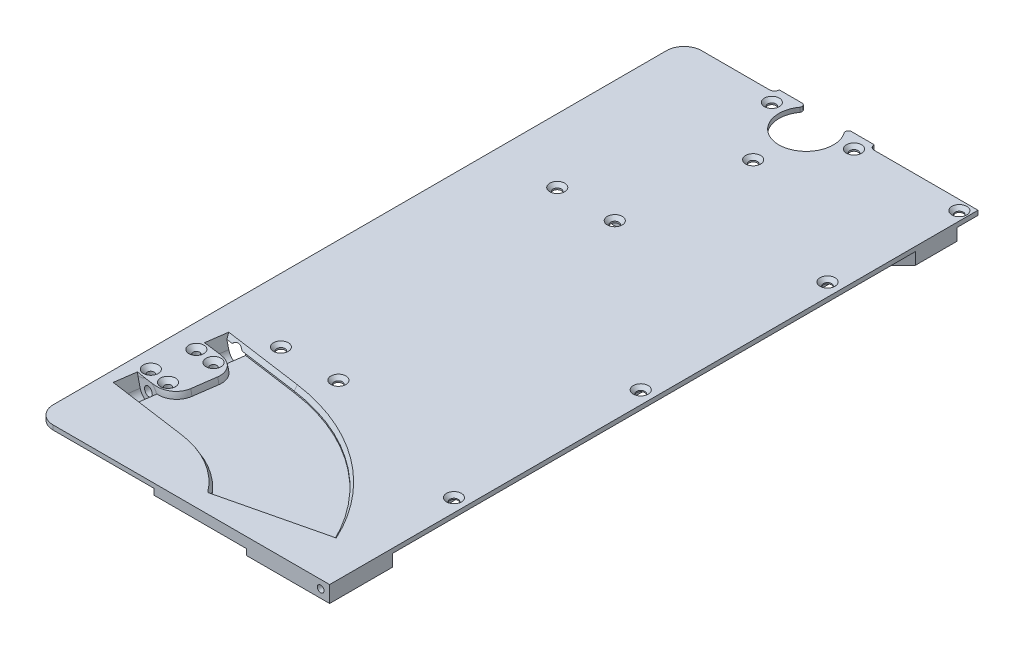
from build123d import *

# Parameters (mm, degrees)
BOSS_EXTRUDE1_DEPTH  = 1.2
SKETCH4_W            = 62.7
SKETCH4_H            = 158
BOSS_EXTRUDE3_DEPTH  = 3.2
SKETCH6_W            = 13.5
SKETCH6_H            = 11.65
SKETCH6_R            = 1.1
SKETCH6_H_2          = 29.2
BOSS_EXTRUDE4_DEPTH  = 5.1
SKETCH7_W            = 0.1
SKETCH7_H            = 11.65
SKETCH7_H_2          = 29.2
BOSS_EXTRUDE5_DEPTH  = 3.2
CUT_EXTRUDE5_DEPTH   = 5.1
CUT_EXTRUDE6_DEPTH   = 5.2
SKETCH11_R           = 1.2
CUT_EXTRUDE7_DEPTH   = 5.4
CUT_EXTRUDE8_DEPTH   = 5
BOSS_EXTRUDE6_DEPTH  = 5
CUT_EXTRUDE9_DEPTH   = 5
BOSS_EXTRUDE7_START  = 5
BOSS_EXTRUDE7_DEPTH  = 5
SKETCH20_W           = 8
SKETCH20_H           = 6
CUT_EXTRUDE10_DEPTH  = 3.6
CUT_EXTRUDE12_DEPTH  = 1.8
CUT_EXTRUDE13_START  = -5.4
SKETCH23_R           = 1.2
CUT_EXTRUDE13_DEPTH  = 5.4
SKETCH24_R           = 0.9
CUT_EXTRUDE14_DEPTH  = 96.780634786
CHAMFER1_SIZE        = 1.1
SKETCH26_R           = 2
CUT_EXTRUDE15_DEPTH  = 12
CUT_EXTRUDE16_START  = 12
SKETCH27_R           = 2
CUT_EXTRUDE16_DEPTH  = 12
CUT_EXTRUDE17_START  = -3.6
CUT_EXTRUDE17_DEPTH  = 1.8
CUT_EXTRUDE18_REACH  = 97.781
SKETCH29_W           = 6.8
SKETCH29_H           = 6.1
CUT_EXTRUDE19_DEPTH  = 3.2
CUT_EXTRUDE20_REACH  = 97.781
SKETCH32_R           = 1.1
CHAMFER2_SIZE        = 0.9
SKETCH34_W           = 47.06
SKETCH34_H           = 10
BOSS_EXTRUDE8_DEPTH  = 1.6
SKETCH35_W           = 22.2
SKETCH35_H           = 10
BOSS_EXTRUDE9_DEPTH  = 1.6
CUT_EXTRUDE21_DEPTH  = 1.6
SKETCH44_R           = 0.9
CUT_EXTRUDE22_DEPTH  = 9
CUT_EXTRUDE23_REACH  = 97.781
SKETCH45_R           = 1.1
CHAMFER3_SIZE        = 0.9
CUT_EXTRUDE24_DEPTH  = 1.8
CHAMFER4_SIZE        = 0.692820323
CHAMFER4_SIZE_2      = 1.2
CUT_EXTRUDE25_DEPTH  = 4
BOSS_EXTRUDE10_START = 0.9
BOSS_EXTRUDE10_DEPTH = 0.9
SKETCH57_R           = 1.1
CUT_EXTRUDE26_DEPTH  = 1.3
CUT_EXTRUDE27_DEPTH  = 0.9
CHAMFER5_SIZE        = 0.9
SKETCH59_W           = 35.8
SKETCH59_H           = 15.9
CUT_EXTRUDE28_DEPTH  = 0.4
SKETCH60_W           = 1.2
SKETCH60_H           = 15.9
CUT_EXTRUDE29_DEPTH  = 3.6
FILLET1_R            = 1.2
CUT_EXTRUDE30_DEPTH  = 3.2
SKETCH62_R           = 2.3
BOSS_EXTRUDE11_DEPTH = 0.1
SKETCH63_R           = 1.1
CUT_EXTRUDE31_DEPTH  = 1.3
CHAMFER6_SIZE        = 0.9
BOSS_EXTRUDE12_DEPTH = 1.2
CUT_EXTRUDE32_REACH  = 98.89
CUT_EXTRUDE33_DEPTH  = 3.1
SKETCH67_W           = 2.4
SKETCH67_H           = 2.9
CUT_EXTRUDE34_DEPTH  = 4
FILLET2_R            = 1.2
SKETCH68_W           = 2.2
SKETCH68_H           = 5
CUT_EXTRUDE35_DEPTH  = 0.2
SKETCH69_W           = 2.2
SKETCH69_H           = 2.2
CUT_EXTRUDE36_DEPTH  = 0.2


with BuildPart() as part:
    # Sketch1 → Boss-Extrude1 (new body)
    with BuildSketch(Plane(origin=(0, 0, 0), x_dir=(1, 0, 0), z_dir=(0, 1, 0))):
        with BuildLine():
            Line((40, 86.8), (-34, 86.8))
            ThreePointArc((-34, 86.8), (-37.323401872, 85.423401872), (-38.7, 82.1))
            Line((-38.7, 82.1), (-38.7, -82.1))
            ThreePointArc((-38.7, -82.1), (-37.323401872, -85.423401872), (-34, -86.8))
            Line((-34, -86.8), (40, -86.8))
            Line((40, -86.8), (40, 86.8))
        make_face()
    extrude(amount=-BOSS_EXTRUDE1_DEPTH)

    # Sketch4 → Boss-Extrude3 (add)
    with BuildSketch(Plane(origin=(0, -1.2, 0), x_dir=(-1, 0, 0), z_dir=(0, -1, 0))):
        with Locations((-8.65, 2.2)):
            Rectangle(SKETCH4_W, SKETCH4_H)
    extrude(amount=BOSS_EXTRUDE3_DEPTH)

    # Sketch6 → Boss-Extrude4 (add)
    # profile 1 of 2: a face of its own
    with BuildSketch(Plane.XZ.offset(1.2)):
        with Locations((-29.55, -70.575)):
            Rectangle(SKETCH6_W, SKETCH6_H)
        with Locations(Location((-25.5, -68.35, 0), (0, 0, 270))):
            Circle(SKETCH6_R, mode=Mode.SUBTRACT)
    # profile 2 of 2: a face of its own
    with BuildSketch(Plane.XZ.offset(1.2)):
        with Locations((-29.55, 56.05)):
            Rectangle(SKETCH6_W, SKETCH6_H_2)
        with Locations(Location((-25.5, 56.05, 0), (0, 0, 270))):
            Circle(SKETCH6_R, mode=Mode.SUBTRACT)
    extrude(amount=BOSS_EXTRUDE4_DEPTH)

    # Sketch7 → Boss-Extrude5 (add)
    with BuildSketch(Plane.XZ.offset(1.2)):
        with Locations((-22.75, -70.575)):
            Rectangle(SKETCH7_W, SKETCH7_H)
        with Locations((-22.75, 56.05)):
            Rectangle(SKETCH7_W, SKETCH7_H_2)
    extrude(amount=BOSS_EXTRUDE5_DEPTH)

    # Sketch10 → Cut-Extrude5 (cut)
    with BuildSketch(Plane.XZ.offset(6.3)):
        Polygon((-25.959839262, 43.33044604), (-25.695559806, 41.45), (-39.339908081, 41.45), align=None)
        Polygon((-29.578339887, 69.077415827), (-29.79935218, 70.65), (-36.3, 70.65), (-36.3, 68.132748105), align=None)
    extrude(amount=-CUT_EXTRUDE5_DEPTH, mode=Mode.SUBTRACT)

    # Sketch9 → Cut-Extrude6 (cut)
    with BuildSketch(Plane(origin=(0, 0, 0), x_dir=(1, 0, 0), z_dir=(0, 1, 0))):
        Polygon((-34.925787458, -68.325881082), (-34.229921954, -63.374540738), (-28.882474382, -64.126075484), (-29.578339887, -69.077415827), align=None)
        Polygon((-25.959839262, -43.33044604), (-31.307286833, -42.578911295), (-32.003152338, -47.530251639), (-26.655704767, -48.281786384), align=None)
    extrude(amount=-CUT_EXTRUDE6_DEPTH, mode=Mode.SUBTRACT)

    # Sketch11 → Cut-Extrude7 (cut)
    with BuildSketch(Plane(origin=(-9.39719998, 0, 66.864552213), x_dir=(0.9902680687415714, 0, 0.13917310096005855), z_dir=(-0.13917310096005855, 0, 0.9902680687415714))):
        with Locations((-22.37676735, -2.5)):
            Circle(SKETCH11_R)
    extrude(amount=-CUT_EXTRUDE7_DEPTH, mode=Mode.SUBTRACT)

    # Sketch15 → Cut-Extrude8 (cut)
    with BuildSketch(Plane(origin=(-9.39719998, 0, 66.864552213), x_dir=(0.9902680687415714, 0, 0.13917310096005855), z_dir=(-0.13917310096005855, 0, 0.9902680687415714))):
        Polygon((-25.902439291, 0), (-25.07676735, 0), (-25.07676735, -2.879460254), align=None)
    extrude(amount=CUT_EXTRUDE8_DEPTH, mode=Mode.SUBTRACT)

    # Sketch17 → Boss-Extrude6 (add)
    with BuildSketch(Plane(origin=(-9.39719998, 0, 66.864552213), x_dir=(0.9902680687415714, 0, 0.13917310096005855), z_dir=(-0.13917310096005855, 0, 0.9902680687415714))):
        with BuildLine():
            Line((-25.07676735, -2.879460254), (-24.972173929, -3.244220861))
            ThreePointArc((-24.972173929, -3.244220861), (-22.000999977, -5.173723786), (-19.67676735, -2.5))
            Line((-19.67676735, -2.5), (-19.67676735, -6.3))
            Line((-19.67676735, -6.3), (-25.07676735, -6.3))
            Line((-25.07676735, -6.3), (-25.07676735, -2.879460254))
        make_face()
    extrude(amount=BOSS_EXTRUDE6_DEPTH)

    # Sketch18 → Cut-Extrude9 (cut)
    with BuildSketch(Plane(origin=(-7.170430365, 0, 51.020263113), x_dir=(-0.9902680687415715, 0, -0.13917310096005736), z_dir=(0.13917310096005736, 0, -0.9902680687415715))):
        Polygon((25.902439291, 0), (25.07676735, 0), (25.07676735, -2.879460254), align=None)
    extrude(amount=CUT_EXTRUDE9_DEPTH, mode=Mode.SUBTRACT)

    # Sketch19 → Boss-Extrude7 (add)
    with BuildSketch(Plane(origin=(-7.170430365, 0, 51.020263113), x_dir=(-0.9902680687415715, 0, -0.13917310096005736), z_dir=(0.13917310096005736, 0, -0.9902680687415715)).offset(BOSS_EXTRUDE7_START)):
        with BuildLine():
            Line((25.07676735, -2.879460254), (24.972173929, -3.244220861))
            ThreePointArc((24.972173929, -3.244220861), (22.000999977, -5.173723786), (19.67676735, -2.5))
            Line((19.67676735, -2.5), (19.67676735, -6.3))
            Line((19.67676735, -6.3), (25.07676735, -6.3))
            Line((25.07676735, -6.3), (25.07676735, -2.879460254))
        make_face()
    extrude(amount=-BOSS_EXTRUDE7_DEPTH)

    # Sketch20 → Cut-Extrude10 (cut)
    with BuildSketch(Plane.XZ.offset(6.3)):
        with Locations((-32.3, 56.05)):
            Rectangle(SKETCH20_W, SKETCH20_H)
    extrude(amount=-CUT_EXTRUDE10_DEPTH, mode=Mode.SUBTRACT)

    # Sketch22 → Cut-Extrude12 (cut)
    with BuildSketch(Plane(origin=(0, -2.7, 0), x_dir=(-1, 0, 0), z_dir=(0, -1, 0))):
        Polygon((24.056624327, -58.55), (26.943375673, -58.55), (28.3, -58.55), (28.3, -53.55), (26.943375673, -53.55), (24.056624327, -53.55), (22.613248654, -56.05), align=None)
    extrude(amount=CUT_EXTRUDE12_DEPTH, mode=Mode.SUBTRACT)

    # Sketch23 → Cut-Extrude13 (cut)
    with BuildSketch(Plane(origin=(-7.170430365, 0, 51.020263113), x_dir=(-0.9902680687415715, 0, -0.13917310096005736), z_dir=(0.13917310096005736, 0, -0.9902680687415715)).offset(CUT_EXTRUDE13_START)):
        with Locations(Location((22.37676735, -2.5, 0), (0, 0, 180))):
            Circle(SKETCH23_R)
    extrude(amount=CUT_EXTRUDE13_DEPTH, mode=Mode.SUBTRACT)

    # Sketch24 → Cut-Extrude14 (cut, through all)
    with BuildSketch(Plane(origin=(0, 0, 0), x_dir=(1, 0, 0), z_dir=(0, 1, 0))):
        with Locations(Location((-32.365002401, -50.104948617, 0), (0, 0, 270))):
            Circle(SKETCH24_R)
        with Locations(Location((-27.01755483, -50.856483363, 0), (0, 0, 270))):
            Circle(SKETCH24_R)
        with Locations(Location((-28.52062432, -61.551378505, 0), (0, 0, 270))):
            Circle(SKETCH24_R)
        with Locations(Location((-33.868071891, -60.79984376, 0), (0, 0, 270))):
            Circle(SKETCH24_R)
    extrude(amount=-CUT_EXTRUDE14_DEPTH, mode=Mode.SUBTRACT)

    # Chamfer1
    chamfer1_edges = [part.edges().sort_by_distance(p)[0] for p in [
        (-32.365002401, 0, 49.204948617),
        (-33.868071891, 0, 59.89984376),
        (-28.52062432, 0, 60.651378505),
        (-27.01755483, 0, 49.956483363),
    ]]
    chamfer(chamfer1_edges, length=CHAMFER1_SIZE)

    # Sketch26 → Cut-Extrude15 (cut)
    with BuildSketch(Plane(origin=(-6.47456486, 0, 46.068922769), x_dir=(-0.9902680687415714, 0, -0.13917310096005867), z_dir=(0.13917310096005867, 0, -0.9902680687415714))):
        with Locations((22.37676735, -2.5)):
            Circle(SKETCH26_R)
    extrude(amount=CUT_EXTRUDE15_DEPTH, mode=Mode.SUBTRACT)

    # Sketch27 → Cut-Extrude16 (cut)
    with BuildSketch(Plane(origin=(-10.093065485, 0, 71.815892556), x_dir=(0.9902680687415714, 0, 0.1391731009600588), z_dir=(-0.1391731009600588, 0, 0.9902680687415714)).offset(CUT_EXTRUDE16_START)):
        with Locations((-22.37676735, -2.5)):
            Circle(SKETCH27_R)
    extrude(amount=-CUT_EXTRUDE16_DEPTH, mode=Mode.SUBTRACT)

    # Sketch28 → Cut-Extrude17 (cut)
    with BuildSketch(Plane.XZ.offset(6.3).offset(CUT_EXTRUDE17_START)):
        Polygon((-26.943375673, -70.85), (-24.056624327, -70.85), (-22.613248654, -68.35), (-24.056624327, -65.85), (-26.943375673, -65.85), (-28.386751346, -65.85), (-28.386751346, -64.75), (-35.186751346, -64.75), (-35.186751346, -70.85), align=None)
    extrude(amount=CUT_EXTRUDE17_DEPTH, mode=Mode.SUBTRACT)

    # Sketch29 → Cut-Extrude18 (cut, up to next)
    with BuildSketch(Plane.XZ.offset(6.3), mode=Mode.PRIVATE) as cut_extrude18_sk1:
        with Locations((-31.786751346, -67.8)):
            Rectangle(SKETCH29_W, SKETCH29_H)
    cut_extrude18_tool1 = extrude(cut_extrude18_sk1.sketch, amount=-CUT_EXTRUDE18_REACH, mode=Mode.PRIVATE) & part.part
    add(cut_extrude18_tool1.solids().sort_by_distance((-31.786751, -6.3, -67.8))[0], mode=Mode.SUBTRACT)

    # Sketch31 → Cut-Extrude19 (cut)
    with BuildSketch(Plane.XZ.offset(4.4)):
        Polygon((40, 70), (32.8, 62.8), (32.8, -62.8), (40, -70), align=None)
    extrude(amount=-CUT_EXTRUDE19_DEPTH, mode=Mode.SUBTRACT)

    # Sketch32 → Cut-Extrude20 (cut, up to next)
    with BuildSketch(Plane(origin=(0, 0, 0), x_dir=(1, 0, 0), z_dir=(0, 1, 0)), mode=Mode.PRIVATE) as cut_extrude20_sk1:
        with Locations(Location((36.5, 50, 0), (0, 0, 270))):
            Circle(SKETCH32_R)
    cut_extrude20_tool1 = extrude(cut_extrude20_sk1.sketch, amount=-CUT_EXTRUDE20_REACH, mode=Mode.PRIVATE) & part.part
    # Sketch32 → Cut-Extrude20 (cut, up to next)
    with BuildSketch(Plane(origin=(0, 0, 0), x_dir=(1, 0, 0), z_dir=(0, 1, 0)), mode=Mode.PRIVATE) as cut_extrude20_sk2:
        with Locations(Location((36.5, 0, 0), (0, 0, 270))):
            Circle(SKETCH32_R)
    cut_extrude20_tool2 = extrude(cut_extrude20_sk2.sketch, amount=-CUT_EXTRUDE20_REACH, mode=Mode.PRIVATE) & part.part
    # Sketch32 → Cut-Extrude20 (cut, up to next)
    with BuildSketch(Plane(origin=(0, 0, 0), x_dir=(1, 0, 0), z_dir=(0, 1, 0)), mode=Mode.PRIVATE) as cut_extrude20_sk3:
        with Locations(Location((36.5, -50, 0), (0, 0, 270))):
            Circle(SKETCH32_R)
    cut_extrude20_tool3 = extrude(cut_extrude20_sk3.sketch, amount=-CUT_EXTRUDE20_REACH, mode=Mode.PRIVATE) & part.part
    add(cut_extrude20_tool1.solids().sort_by_distance((36.5, 0, -50))[0], mode=Mode.SUBTRACT)
    add(cut_extrude20_tool2.solids().sort_by_distance((36.5, 0, 0))[0], mode=Mode.SUBTRACT)
    add(cut_extrude20_tool3.solids().sort_by_distance((36.5, 0, 50))[0], mode=Mode.SUBTRACT)

    # Chamfer2
    chamfer2_edges = [part.edges().sort_by_distance(p)[0] for p in [
        (36.5, 0, -51.1),
        (36.5, 0, -1.1),
        (36.5, 0, 48.9),
    ]]
    chamfer(chamfer2_edges, length=CHAMFER2_SIZE)

    # Sketch34 → Boss-Extrude8 (add)
    with BuildSketch(Plane(origin=(0, -1.2, 0), x_dir=(-1, 0, 0), z_dir=(0, -1, 0))):
        with Locations((-16.47, -81.8)):
            Rectangle(SKETCH34_W, SKETCH34_H)
    extrude(amount=BOSS_EXTRUDE8_DEPTH)

    # Sketch35 → Boss-Extrude9 (add)
    with BuildSketch(Plane.XZ.offset(2.8)):
        with Locations((28.9, 81.8)):
            Rectangle(SKETCH35_W, SKETCH35_H)
    extrude(amount=BOSS_EXTRUDE9_DEPTH)

    # Sketch33 → Cut-Extrude21 (cut)
    with BuildSketch(Plane(origin=(0, 0, 0), x_dir=(1, 0, 0), z_dir=(0, 1, 0))):
        with BuildLine():
            Line((-29.080527996, -64.098240863), (-31.754251782, -63.722473491))
            Line((-31.754251782, -63.722473491), (-32.450117287, -68.673813835))
            Line((-32.450117287, -68.673813835), (-14.392579053, -71.211635331))
            ThreePointArc((-14.392579053, -71.211635331), (-4.943505274, -74.455866069), (2.613784833, -80.990190411))
            Line((2.613784833, -80.990190411), (29.104169117, -74.640190865))
            ThreePointArc((29.104169117, -74.640190865), (12.827852723, -55.045960017), (-10.774078428, -45.464665543))
            Line((-10.774078428, -45.464665543), (-28.831616662, -42.926844047))
            Line((-28.831616662, -42.926844047), (-29.527482166, -47.878184391))
            Line((-29.527482166, -47.878184391), (-26.853758381, -48.253951764))
            ThreePointArc((-26.853758381, -48.253951764), (-23.688338817, -50.118526382), (-22.768502535, -53.675269378))
            Line((-22.768502535, -53.675269378), (-23.659210382, -60.012985018))
            ThreePointArc((-23.659210382, -60.012985018), (-25.523785, -63.178404582), (-29.080527996, -64.098240863))
        make_face()
    extrude(amount=-CUT_EXTRUDE21_DEPTH, mode=Mode.SUBTRACT)

    # Sketch44 → Cut-Extrude22 (cut)
    with BuildSketch(Plane.XY.offset(86.8)):
        with Locations((37.6, -2.2)):
            Circle(SKETCH44_R)
    extrude(amount=-CUT_EXTRUDE22_DEPTH, mode=Mode.SUBTRACT)

    # Sketch45 → Cut-Extrude23 (cut, up to next)
    with BuildSketch(Plane(origin=(0, 0, 0), x_dir=(1, 0, 0), z_dir=(0, 1, 0)), mode=Mode.PRIVATE) as cut_extrude23_sk1:
        with Locations(Location((37.6, 84.2, 0), (0, 0, 270))):
            Circle(SKETCH45_R)
    cut_extrude23_tool1 = extrude(cut_extrude23_sk1.sketch, amount=-CUT_EXTRUDE23_REACH, mode=Mode.PRIVATE) & part.part
    add(cut_extrude23_tool1.solids().sort_by_distance((37.6, 0, -84.2))[0], mode=Mode.SUBTRACT)

    # Chamfer3
    chamfer3_edges = [part.edges().sort_by_distance(p)[0] for p in [
        (37.6, 0, -85.3),
    ]]
    chamfer(chamfer3_edges, length=CHAMFER3_SIZE)

    # Cut-Sweep2: sweep along a path in Sketch54
    with BuildLine(Plane(origin=(-7.170430365, 0, 51.020263113), x_dir=(-0.9902680687415714, 0, -0.13917310096005867), z_dir=(0.13917310096005867, 0, -0.9902680687415714))) as cut_sweep2_path:
        ThreePointArc((19.87676735, -1.6), (21.591001751, 0.038222296), (23.930996266, -0.34491938))
    # Sketch51 → Cut-Sweep2 (sweep, cut)
    with BuildSketch(Plane(origin=(0, -1.6, 0), x_dir=(1, 0, 0), z_dir=(0, 1, 0))):
        with BuildLine():
            Line((-29.080527996, -64.098240863), (-29.776393501, -69.049581207))
            Line((-29.776393501, -69.049581207), (-20.071766427, -70.413477597))
            Line((-20.071766427, -70.413477597), (-16.453265802, -44.666507809))
            Line((-16.453265802, -44.666507809), (-26.157892876, -43.30261142))
            Line((-26.157892876, -43.30261142), (-26.853758381, -48.253951764))
            ThreePointArc((-26.853758381, -48.253951764), (-23.688338817, -50.118526382), (-22.768502535, -53.675269378))
            Line((-22.768502535, -53.675269378), (-23.659210382, -60.012985018))
            ThreePointArc((-23.659210382, -60.012985018), (-25.523785, -63.178404582), (-29.080527996, -64.098240863))
        make_face()
    sweep(path=cut_sweep2_path.line, mode=Mode.SUBTRACT)

    # Sketch53 → Cut-Extrude24 (cut)
    with BuildSketch(Plane(origin=(-21.988115952, -6.366953545, -3.090228169), x_dir=(0.1285029089350593, 0.03720973881399481, -0.9910108161531953), z_dir=(0.9519067631920858, 0.2756373558170021, 0.1337817710578607))):
        with BuildLine():
            Line((-67.228559302, 8.873737948), (-72.224811879, 9.0672843))
            Line((-72.224811879, 9.0672843), (-71.84546103, 18.85993935))
            Line((-71.84546103, 18.85993935), (-45.864947631, 17.853498322))
            Line((-45.864947631, 17.853498322), (-46.24429848, 8.060843272))
            Line((-46.24429848, 8.060843272), (-51.240551057, 8.254389624))
            ThreePointArc((-51.240551057, 8.254389624), (-52.514001196, 11.700379215), (-55.851149033, 13.236596595))
            Line((-55.851149033, 13.236596595), (-62.246352331, 13.484335925))
            ThreePointArc((-62.246352331, 13.484335925), (-65.692341923, 12.210885785), (-67.228559302, 8.873737948))
        make_face()
    extrude(amount=-CUT_EXTRUDE24_DEPTH, mode=Mode.SUBTRACT)

    # Chamfer4
    # the kernel refuses this chamfer: 1.2, 0.692820323 mm, written as the material it takes off along each edge
    with BuildSketch(Plane(origin=(-35.199213489, 0, 42.031936674), x_dir=(0.1389396720071673, 0.05789386240267059, -0.988607135437855), z_dir=(0.9902680687415716, 0, 0.13917310096005664))) as chamfer4_piece_1_section:
        Polygon((CHAMFER4_SIZE * 0.998322743793, -CHAMFER4_SIZE * 0.057893862405), (-CHAMFER4_SIZE_2 * 0.0578938624027, -CHAMFER4_SIZE_2 * 0.998322743754), (0, 0), align=None)
    chamfer4_piece_1 = extrude(amount=24.665174847, mode=Mode.PRIVATE)
    chamfer4_piece_1 = split(chamfer4_piece_1, bisect_by=Plane(origin=(-31.173280957, -3.242303157, 42.372993541), z_dir=(0.9519067631920863, 0.27563735581700083, 0.13378177105785954)), keep=Keep.TOP, mode=Mode.PRIVATE)
    add(chamfer4_piece_1, mode=Mode.SUBTRACT)
    with BuildSketch(Plane(origin=(-14.392579053, 0, 71.211635331), x_dir=(-0.13893967200716834, 0.0578938624026716, 0.9886071354378548), z_dir=(-0.9902680687415715, 0, -0.13917310096005767))) as chamfer4_piece_2_section:
        Polygon((CHAMFER4_SIZE * 0.998322743793, -CHAMFER4_SIZE * 0.057893862405), (-CHAMFER4_SIZE_2 * 0.0578938624027, -CHAMFER4_SIZE_2 * 0.998322743754), (0, 0), align=None)
    chamfer4_piece_2 = extrude(amount=24.665174847, mode=Mode.PRIVATE)
    chamfer4_piece_2 = split(chamfer4_piece_2, bisect_by=Plane(origin=(-34.853731367, -3.242303157, 68.560758957), z_dir=(0.9519067631920858, 0.2756373558170021, 0.1337817710578607)), keep=Keep.TOP, mode=Mode.PRIVATE)
    add(chamfer4_piece_2, mode=Mode.SUBTRACT)
    with BuildSketch(Plane(origin=(-18.052692435, 0, 97.25469527), x_dir=(0.13917310096005922, 0, -0.9902680687415711), z_dir=(-0.9902680687415711, 0, -0.13917310096005922))) as chamfer4_piece_3_section:
        Polygon((26.299 - CHAMFER4_SIZE, 0), (26.299, CHAMFER4_SIZE_2), (26.299, 0), align=None)
    chamfer4_piece_3 = revolve(axis=Axis((-18.052692435, 0, 97.25469527), (0, -1, 0)), revolution_arc=50.561481417, mode=Mode.PRIVATE)
    chamfer4_piece_3 = split(chamfer4_piece_3, bisect_by=Plane(origin=(-3.266951015, -0.589463336, 82.399859277), z_dir=(-0.23310592850732814, 0, -0.972451348960315)), keep=Keep.TOP, mode=Mode.PRIVATE)
    add(chamfer4_piece_3, mode=Mode.SUBTRACT)
    with BuildSketch(Plane(origin=(-0.405193205, 0, 81.713868444), x_dir=(0.23271495013271126, 0.05789386240267092, 0.9708202988611385), z_dir=(0.972451348960315, 0, -0.23310592850732814))) as chamfer4_piece_4_section:
        Polygon((CHAMFER4_SIZE * 0.998322743793, CHAMFER4_SIZE * 0.057893862405), (-CHAMFER4_SIZE_2 * 0.0578938624027, CHAMFER4_SIZE_2 * 0.998322743754), (0, 0), align=None)
    chamfer4_piece_4 = extrude(amount=33.449838283, mode=Mode.PRIVATE)
    chamfer4_piece_4 = chamfer4_piece_4 - Plane(origin=(-18.052692435, -0.402717997, 97.25469527), x_dir=(0.13917310096005925, 0, -0.9902680687415713), z_dir=(0, 1, 0)) * Cylinder(26.299, 72, mode=Mode.PRIVATE)
    chamfer4_piece_4 = chamfer4_piece_4 & Plane(origin=(-18.052692435, -0.402717997, 97.25469527), x_dir=(0.9016780732414791, 0, -0.4324079696716214), z_dir=(0, 1, 0)) * Cylinder(52.299, 72, mode=Mode.PRIVATE)
    add(chamfer4_piece_4, mode=Mode.SUBTRACT)
    with BuildSketch(Plane(origin=(-18.052692435, 0, 97.25469527), x_dir=(0.9257464105265759, 0, -0.3781449238019208), z_dir=(0.3781449238019208, 0, 0.9257464105265759))) as chamfer4_piece_5_section:
        Polygon((52.299 + CHAMFER4_SIZE, 0), (52.299, -CHAMFER4_SIZE_2), (52.299, 0), align=None)
    chamfer4_piece_5 = revolve(axis=Axis((-18.052692435, 0, 97.25469527), (0, 1, 0)), revolution_arc=59.781177786, mode=Mode.PRIVATE)
    chamfer4_piece_5 = split(chamfer4_piece_5, bisect_by=Plane(origin=(18.44026869, -0.585495561, 77.196430221), z_dir=(-0.23310592850732814, 0, -0.972451348960315)), keep=Keep.TOP, mode=Mode.PRIVATE)
    add(chamfer4_piece_5, mode=Mode.SUBTRACT)
    with BuildSketch(Plane(origin=(-18.052692435, 0, 97.25469527), x_dir=(0.13917310096005922, 0, -0.9902680687415711), z_dir=(-0.9902680687415711, 0, -0.13917310096005922))) as chamfer4_piece_6a_section:
        Polygon((26.299 - CHAMFER4_SIZE, 0), (26.299, CHAMFER4_SIZE_2), (26.299, 0), align=None)
    chamfer4_piece_6a = revolve(axis=Axis((-18.052692435, 0, 97.25469527), (0, -1, 0)), revolution_arc=50.561481417, mode=Mode.PRIVATE)
    chamfer4_piece_6a = split(chamfer4_piece_6a, bisect_by=Plane(origin=(2.966857606, -0.399252117, 80.905555476), z_dir=(0.23310592850732814, 0, 0.972451348960315)), keep=Keep.TOP, mode=Mode.PRIVATE)
    with BuildSketch(Plane(origin=(-0.405193205, 0, 81.713868444), x_dir=(0.23271495013271126, 0.05789386240267092, 0.9708202988611385), z_dir=(0.972451348960315, 0, -0.23310592850732814))) as chamfer4_piece_6b_section:
        Polygon((CHAMFER4_SIZE * 0.998322743793, CHAMFER4_SIZE * 0.057893862405), (-CHAMFER4_SIZE_2 * 0.0578938624027, CHAMFER4_SIZE_2 * 0.998322743754), (0, 0), align=None)
    chamfer4_piece_6b = extrude(amount=33.449838283, mode=Mode.PRIVATE)
    chamfer4_piece_6b = chamfer4_piece_6b & Plane(origin=(-18.052692435, -0.398316114, 97.25469527), x_dir=(0.13917310096005925, 0, -0.9902680687415713), z_dir=(0, 1, 0)) * Cylinder(26.299, 72, mode=Mode.PRIVATE)
    chamfer4_piece_6 = chamfer4_piece_6a & chamfer4_piece_6b
    add(chamfer4_piece_6, mode=Mode.SUBTRACT)
    with BuildSketch(Plane(origin=(-18.052692435, 0, 97.25469527), x_dir=(0.9257464105265759, 0, -0.3781449238019208), z_dir=(0.3781449238019208, 0, 0.9257464105265759))) as chamfer4_piece_7a_section:
        Polygon((52.299 + CHAMFER4_SIZE, 0), (52.299, -CHAMFER4_SIZE_2), (52.299, 0), align=None)
    chamfer4_piece_7a = revolve(axis=Axis((-18.052692435, 0, 97.25469527), (0, 1, 0)), revolution_arc=59.781177786, mode=Mode.PRIVATE)
    chamfer4_piece_7a = split(chamfer4_piece_7a, bisect_by=Plane(origin=(29.607674761, -0.40396487, 74.519495726), z_dir=(0.23310592850732814, 0, 0.972451348960315)), keep=Keep.TOP, mode=Mode.PRIVATE)
    with BuildSketch(Plane(origin=(-0.405193205, 0, 81.713868444), x_dir=(0.23271495013271126, 0.05789386240267092, 0.9708202988611385), z_dir=(0.972451348960315, 0, -0.23310592850732814))) as chamfer4_piece_7b_section:
        Polygon((CHAMFER4_SIZE * 0.998322743793, CHAMFER4_SIZE * 0.057893862405), (-CHAMFER4_SIZE_2 * 0.0578938624027, CHAMFER4_SIZE_2 * 0.998322743754), (0, 0), align=None)
    chamfer4_piece_7b = extrude(amount=33.449838283, mode=Mode.PRIVATE)
    chamfer4_piece_7b = chamfer4_piece_7b - Plane(origin=(-18.052692435, -0.404495365, 97.25469527), x_dir=(0.9016780732414791, 0, -0.4324079696716214), z_dir=(0, 1, 0)) * Cylinder(52.299, 72, mode=Mode.PRIVATE)
    chamfer4_piece_7 = chamfer4_piece_7a & chamfer4_piece_7b
    add(chamfer4_piece_7, mode=Mode.SUBTRACT)

    # Sketch55 → Cut-Extrude25 (cut)
    with BuildSketch(Plane.XZ.offset(4.4)):
        with BuildLine():
            Line((-3, 38.25), (-3, -35.75))
            ThreePointArc((-3, -35.75), (-3.9372583, -38.0127417), (-6.2, -38.95))
            Line((-6.2, -38.95), (-38.8, -38.95))
            Line((-38.8, -38.95), (-38.8, 41.45))
            Line((-38.8, 41.45), (-6.2, 41.45))
            ThreePointArc((-6.2, 41.45), (-3.9372583, 40.5127417), (-3, 38.25))
        make_face()
    extrude(amount=-CUT_EXTRUDE25_DEPTH, mode=Mode.SUBTRACT)

    # Sketch56 → Boss-Extrude10 (add)
    with BuildSketch(Plane.XZ.offset(0.4).offset(BOSS_EXTRUDE10_START)):
        with BuildLine():
            Line((-3, 35.95), (-21.6, 35.95))
            ThreePointArc((-21.6, 35.95), (-23.226345597, 36.623654403), (-23.9, 38.25))
            Line((-23.9, 38.25), (-23.9, 41.45))
            Line((-23.9, 41.45), (-6.2, 41.45))
            ThreePointArc((-6.2, 41.45), (-3.9372583, 40.5127417), (-3, 38.25))
            Line((-3, 38.25), (-3, 35.95))
        make_face()
        with BuildLine():
            Line((-3, -33.45), (-21.6, -33.45))
            ThreePointArc((-21.6, -33.45), (-23.226345597, -34.123654403), (-23.9, -35.75))
            Line((-23.9, -35.75), (-23.9, -38.95))
            Line((-23.9, -38.95), (-6.2, -38.95))
            ThreePointArc((-6.2, -38.95), (-3.9372583, -38.0127417), (-3, -35.75))
            Line((-3, -35.75), (-3, -33.45))
        make_face()
    extrude(amount=-BOSS_EXTRUDE10_DEPTH)

    # Sketch57 → Cut-Extrude26 (cut)
    with BuildSketch(Plane(origin=(0, -1.3, 0), x_dir=(-1, 0, 0), z_dir=(0, -1, 0))):
        with Locations(Location((21.6, 35.75, 0), (0, 0, 90))):
            Circle(SKETCH57_R)
        with Locations(Location((6.2, 35.75, 0), (0, 0, 90))):
            Circle(SKETCH57_R)
        with Locations(Location((6.2, -38.25, 0), (0, 0, 90))):
            Circle(SKETCH57_R)
        with Locations(Location((21.6, -38.25, 0), (0, 0, 90))):
            Circle(SKETCH57_R)
    extrude(amount=-CUT_EXTRUDE26_DEPTH, mode=Mode.SUBTRACT)

    # Sketch58 → Cut-Extrude27 (cut)
    with BuildSketch(Plane.XZ.offset(1.3)):
        with BuildLine():
            Line((-22.7, -38.95), (-22.7, -37.769900988))
            ThreePointArc((-22.7, -37.769900988), (-23.577371993, -36.924734012), (-23.9, -35.75))
            Line((-23.9, -35.75), (-23.9, -38.95))
            Line((-23.9, -38.95), (-22.7, -38.95))
        make_face()
    extrude(amount=-CUT_EXTRUDE27_DEPTH, mode=Mode.SUBTRACT)

    # Chamfer5
    chamfer5_edges = [part.edges().sort_by_distance(p)[0] for p in [
        (-21.6, 0, 39.35),
        (-6.2, 0, 39.35),
        (-6.2, 0, -34.65),
        (-21.6, 0, -34.65),
    ]]
    chamfer(chamfer5_edges, length=CHAMFER5_SIZE)

    # Sketch59 → Cut-Extrude28 (cut)
    with BuildSketch(Plane.XZ.offset(4.4)):
        with Locations((14.9, 25.85)):
            Rectangle(SKETCH59_W, SKETCH59_H)
    extrude(amount=-CUT_EXTRUDE28_DEPTH, mode=Mode.SUBTRACT)

    # Sketch60 → Cut-Extrude29 (cut)
    with BuildSketch(Plane.XZ.offset(4)):
        with Locations((-2.4, 25.85)):
            Rectangle(SKETCH60_W, SKETCH60_H)
    extrude(amount=-CUT_EXTRUDE29_DEPTH, mode=Mode.SUBTRACT)

    # Fillet1
    fillet1_edges = [part.edges().sort_by_distance(p)[0] for p in [
        (-1.8, -4, 25.85),
        (-1.8, -0.4, 25.85),
    ]]
    fillet(fillet1_edges, radius=FILLET1_R)

    # Sketch61 → Cut-Extrude30 (cut)
    with BuildSketch(Plane.XZ.offset(4.4)):
        with BuildLine():
            Line((-16, -86.8), (-16, -68.6))
            ThreePointArc((-16, -68.6), (-15.004163056, -66.195836944), (-12.6, -65.2))
            Line((-12.6, -65.2), (9, -65.2))
            ThreePointArc((9, -65.2), (11.404163056, -66.195836944), (12.4, -68.6))
            Line((12.4, -68.6), (12.4, -86.8))
            Line((12.4, -86.8), (-16, -86.8))
        make_face()
    extrude(amount=-CUT_EXTRUDE30_DEPTH, mode=Mode.SUBTRACT)

    # Sketch62 → Boss-Extrude11 (add)
    with BuildSketch(Plane.XZ.offset(1.2)):
        with Locations(Location((9.2, -84.4, 0), (0, 0, 270))):
            Circle(SKETCH62_R)
        with Locations(Location((-12.6, -84.2, 0), (0, 0, 270))):
            Circle(SKETCH62_R)
        with BuildLine():
            Line((-4.1, -65.2), (-4.1, -68.4))
            ThreePointArc((-4.1, -68.4), (-1.8, -70.7), (0.5, -68.4))
            Line((0.5, -68.4), (0.5, -65.2))
            Line((0.5, -65.2), (-4.1, -65.2))
        make_face()
    extrude(amount=BOSS_EXTRUDE11_DEPTH)

    # Sketch63 → Cut-Extrude31 (cut)
    with BuildSketch(Plane.XZ.offset(1.3)):
        with Locations(Location((-1.8, -68.4, 0), (0, 0, 270))):
            Circle(SKETCH63_R)
        with Locations(Location((9.2, -84.4, 0), (0, 0, 270))):
            Circle(SKETCH63_R)
        with Locations(Location((-12.6, -84.2, 0), (0, 0, 270))):
            Circle(SKETCH63_R)
    extrude(amount=-CUT_EXTRUDE31_DEPTH, mode=Mode.SUBTRACT)

    # Chamfer6
    chamfer6_edges = [part.edges().sort_by_distance(p)[0] for p in [
        (-1.8, 0, -67.3),
        (9.2, 0, -83.3),
        (-12.6, 0, -83.1),
    ]]
    chamfer(chamfer6_edges, length=CHAMFER6_SIZE)

    # Sketch64 → Boss-Extrude12 (add)
    with BuildSketch(Plane.XZ.offset(1.2)):
        with BuildLine():
            Line((10.9, -88.1), (-14.5, -88.1))
            ThreePointArc((-14.5, -88.1), (-14.880761184, -87.180761184), (-15.8, -86.8))
            Line((-15.8, -86.8), (12.2, -86.8))
            ThreePointArc((12.2, -86.8), (11.280761184, -87.180761184), (10.9, -88.1))
        make_face()
    extrude(amount=-BOSS_EXTRUDE12_DEPTH)

    # Sketch65 → Cut-Extrude32 (cut, up to next)
    with BuildSketch(Plane.XZ.offset(1.2), mode=Mode.PRIVATE) as cut_extrude32_sk1:
        with BuildLine():
            Line((-8.396969001, -88.1), (4.796969001, -88.1))
            ThreePointArc((4.796969001, -88.1), (4.08585789, -87.666498278), (4.145416507, -86.835802469))
            ThreePointArc((4.145416507, -86.835802469), (-1.8, -75.3), (-7.745416507, -86.835802469))
            ThreePointArc((-7.745416507, -86.835802469), (-7.68585789, -87.666498278), (-8.396969001, -88.1))
        make_face()
    cut_extrude32_tool1 = extrude(cut_extrude32_sk1.sketch, amount=-CUT_EXTRUDE32_REACH, mode=Mode.PRIVATE) & part.part
    add(cut_extrude32_tool1.solids().sort_by_distance((-1.8, -1.2, -82.172197))[0], mode=Mode.SUBTRACT)

    # Sketch66 → Cut-Extrude33 (cut)
    with BuildSketch(Plane.XZ.offset(4.4)):
        with BuildLine():
            Line((-10.15, -38.95), (-10.15, -65.2))
            Line((-10.15, -65.2), (-12.6, -65.2))
            ThreePointArc((-12.6, -65.2), (-12.825496489, -65.207485986), (-13.05, -65.22991098))
            Line((-13.05, -65.22991098), (-13.05, -38.95))
            Line((-13.05, -38.95), (-10.15, -38.95))
        make_face()
    extrude(amount=-CUT_EXTRUDE33_DEPTH, mode=Mode.SUBTRACT)

    # Sketch67 → Cut-Extrude34 (cut)
    with BuildSketch(Plane.XZ.offset(4.4)):
        with Locations((-1.8, 1.95)):
            Rectangle(SKETCH67_W, SKETCH67_H)
    extrude(amount=-CUT_EXTRUDE34_DEPTH, mode=Mode.SUBTRACT)

    # Fillet2
    fillet2_edges = [part.edges().sort_by_distance(p)[0] for p in [
        (-0.6, -0.4, 1.95),
    ]]
    fillet(fillet2_edges, radius=FILLET2_R)

    # Sketch68 → Cut-Extrude35 (cut)
    with BuildSketch(Plane(origin=(0, -4.5, 0), x_dir=(1, 0, 0), z_dir=(0, 1, 0))):
        with Locations((-25.5, -56.05)):
            Rectangle(SKETCH68_W, SKETCH68_H)
        with Locations((-25.5, 68.35)):
            Rectangle(SKETCH68_W, SKETCH68_H)
    extrude(amount=-CUT_EXTRUDE35_DEPTH, mode=Mode.SUBTRACT)

    # Sketch69 → Cut-Extrude36 (cut)
    with BuildSketch(Plane(origin=(0, -4.7, 0), x_dir=(1, 0, 0), z_dir=(0, 1, 0))):
        with Locations((-25.5, -56.05)):
            Rectangle(SKETCH69_W, SKETCH69_H)
        with Locations((-25.5, 68.35)):
            Rectangle(SKETCH69_W, SKETCH69_H)
    extrude(amount=-CUT_EXTRUDE36_DEPTH, mode=Mode.SUBTRACT)


solid = part.part
